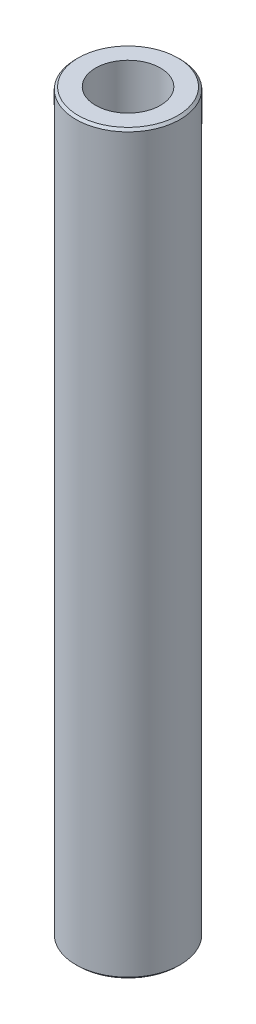
from build123d import *

# Parameters (mm, degrees)
SKETCH1_R           = 42.5
BOSS_EXTRUDE1_DEPTH = 600
SKETCH2_R           = 26.398504345
CUT_EXTRUDE1_DEPTH  = 604.002902149
CHAMFER1_SIZE       = 1.88269241


with BuildPart() as part:
    # Sketch1 → Boss-Extrude1 (new body)
    with BuildSketch(Plane(origin=(0, 0, 0), x_dir=(1, 0, 0), z_dir=(0, 1, 0))):
        Circle(SKETCH1_R)
    extrude(amount=BOSS_EXTRUDE1_DEPTH)

    # Sketch2 → Cut-Extrude1 (cut, through all)
    with BuildSketch(Plane(origin=(0, 0, 0), x_dir=(1, 0, 0), z_dir=(0, 1, 0))):
        Circle(SKETCH2_R)
    extrude(amount=CUT_EXTRUDE1_DEPTH, mode=Mode.SUBTRACT)

    # Chamfer1
    chamfer1_edges = [part.edges().sort_by_distance(p)[0] for p in [
        (-42.5, 600, 0),
        (-42.5, 0, 0),
    ]]
    chamfer(chamfer1_edges, length=CHAMFER1_SIZE)


solid = part.part
